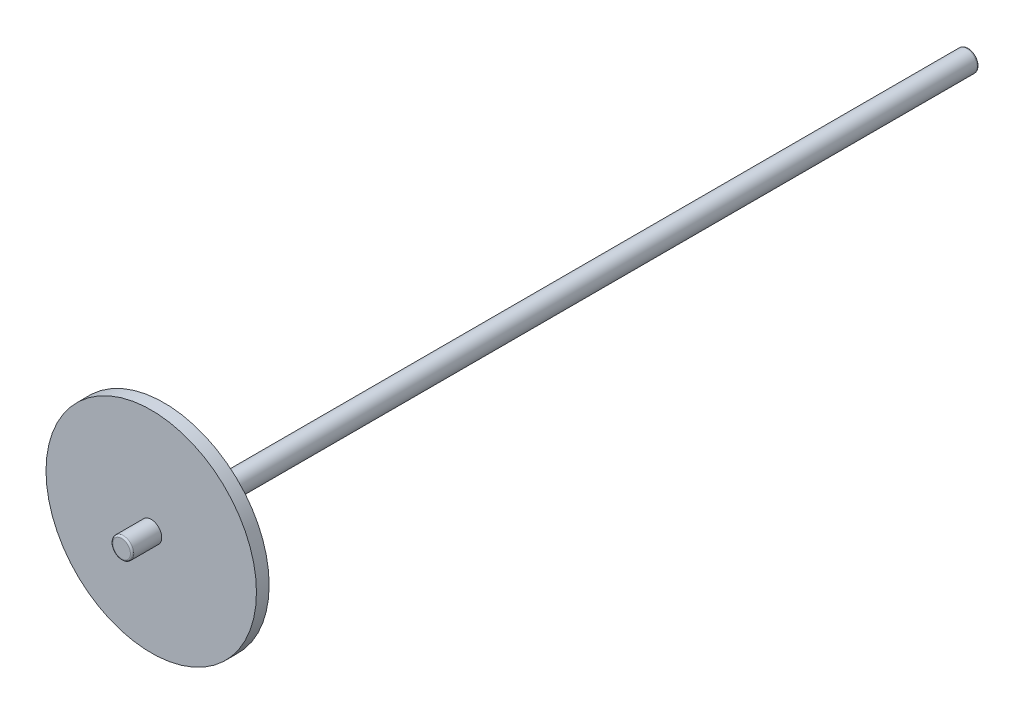
from build123d import *

# Parameters (mm, degrees)
ESBO_O1_R                = 12.425
ESBO_O1_R_2              = 1.2415
RESSALTO_EXTRUS_O1_DEPTH = 1.5
RESSALTO_EXTRUS_O2_START = -1
ESBO_O2_R                = 2.2
ESBO_O2_R_2              = 1.2415
RESSALTO_EXTRUS_O2_DEPTH = 1
RESSALTO_EXTRUS_O3_START = -100
ESBO_O3_R                = 1.2415
RESSALTO_EXTRUS_O3_DEPTH = 100
FILETE1_R                = 0.2


with BuildPart() as part:
    # Esboço1 → Ressalto-extrusão1 (new body)
    with BuildSketch(Plane.XY):
        Circle(ESBO_O1_R)
        Circle(ESBO_O1_R_2, mode=Mode.SUBTRACT)
    extrude(amount=RESSALTO_EXTRUS_O1_DEPTH)

    # Esboço2 → Ressalto-extrusão2 (add)
    with BuildSketch(Plane.XY.offset(RESSALTO_EXTRUS_O2_START)):
        Circle(ESBO_O2_R)
        Circle(ESBO_O2_R_2, mode=Mode.SUBTRACT)
    extrude(amount=RESSALTO_EXTRUS_O2_DEPTH)

    # Esboço3 → Ressalto-extrusão3 (add)
    with BuildSketch(Plane.XY.offset(5).offset(RESSALTO_EXTRUS_O3_START)):
        Circle(ESBO_O3_R)
    extrude(amount=RESSALTO_EXTRUS_O3_DEPTH)

    # Filete1
    filete1_edges = [part.edges().sort_by_distance(p)[0] for p in [
        (-1.2415, 0, -95),
        (-1.2415, 0, 5),
    ]]
    fillet(filete1_edges, radius=FILETE1_R)


solid = part.part
